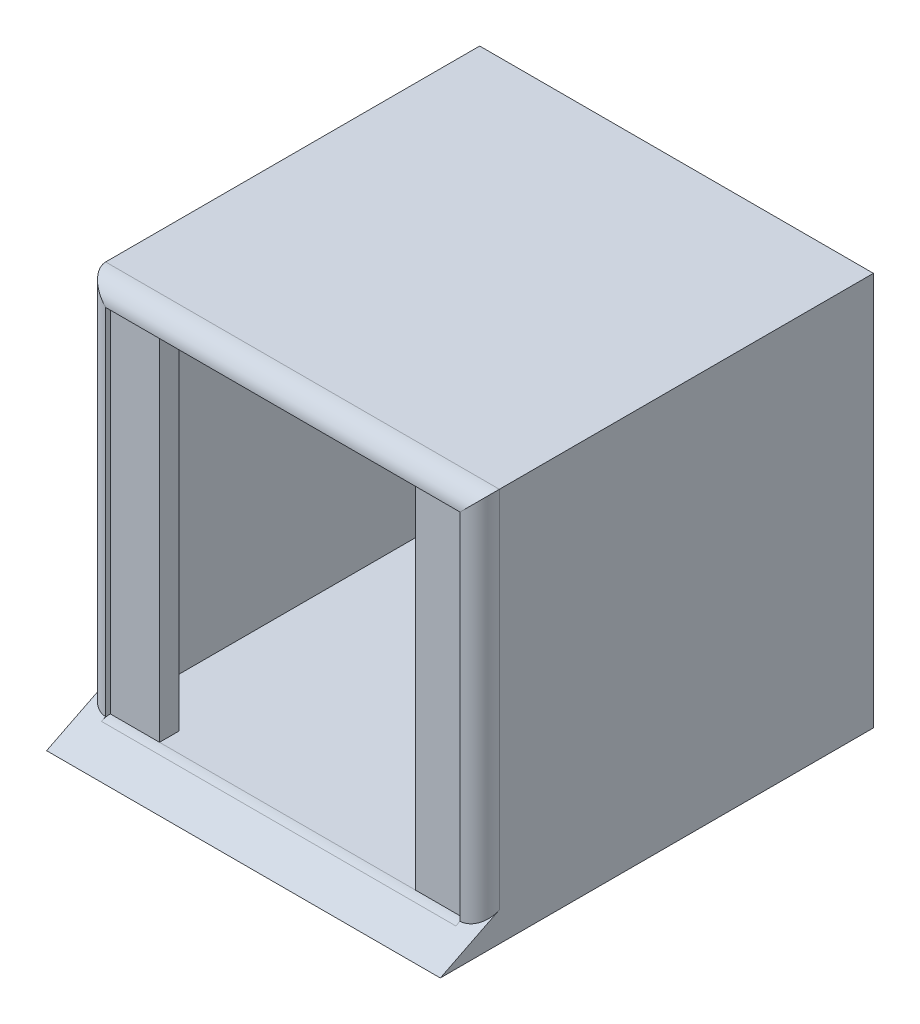
from build123d import *

# Parameters (mm, degrees)
SKETCH1_W           = 2000
SKETCH1_H           = 2000
BOSS_EXTRUDE1_DEPTH = 2000
SHELL3_T            = -100
BOSS_EXTRUDE2_DEPTH = 2000
FILLET1_R           = 100
SKETCH3_W           = 250
SKETCH3_H           = 100
BOSS_EXTRUDE3_DEPTH = 1800


with BuildPart() as part:
    # Sketch1 → Boss-Extrude1 (new body)
    with BuildSketch(Plane(origin=(0, 0, 0), x_dir=(1, 0, 0), z_dir=(0, 1, 0))):
        with Locations((1000, 1000)):
            Rectangle(SKETCH1_W, SKETCH1_H)
    extrude(amount=BOSS_EXTRUDE1_DEPTH)

    # Shell3
    shell3_openings = [part.faces().sort_by_distance(p)[0] for p in [
        (1000, 1000, 0),
    ]]
    offset(amount=SHELL3_T, openings=shell3_openings, kind=Kind.INTERSECTION)

    # Sketch2 → Boss-Extrude2 (add)
    with BuildSketch(Plane(origin=(0, 0, 0), x_dir=(0, 0, -1), z_dir=(1, 0, 0))):
        Polygon((0, 100), (-200, 0), (0, 0), align=None)
    extrude(amount=BOSS_EXTRUDE2_DEPTH)

    # Fillet1
    fillet1_edges = [part.edges().sort_by_distance(p)[0] for p in [
        (0, 1050, 0),
        (2000, 1050, 0),
        (1000, 2000, 0),
        (1000, 100, 0),
    ]]
    fillet(fillet1_edges, radius=FILLET1_R - 0.0001)  # a hair under: the kernel refuses the full size

    # Sketch3 → Boss-Extrude3 (add)
    with BuildSketch(Plane(origin=(0, 100, 0), x_dir=(1, 0, 0), z_dir=(0, 1, 0))):
        with Locations((1775, 73.60679775)):
            Rectangle(SKETCH3_W, SKETCH3_H)
        with Locations((225, 73.60679775)):
            Rectangle(SKETCH3_W, SKETCH3_H)
    extrude(amount=BOSS_EXTRUDE3_DEPTH)


solid = part.part
